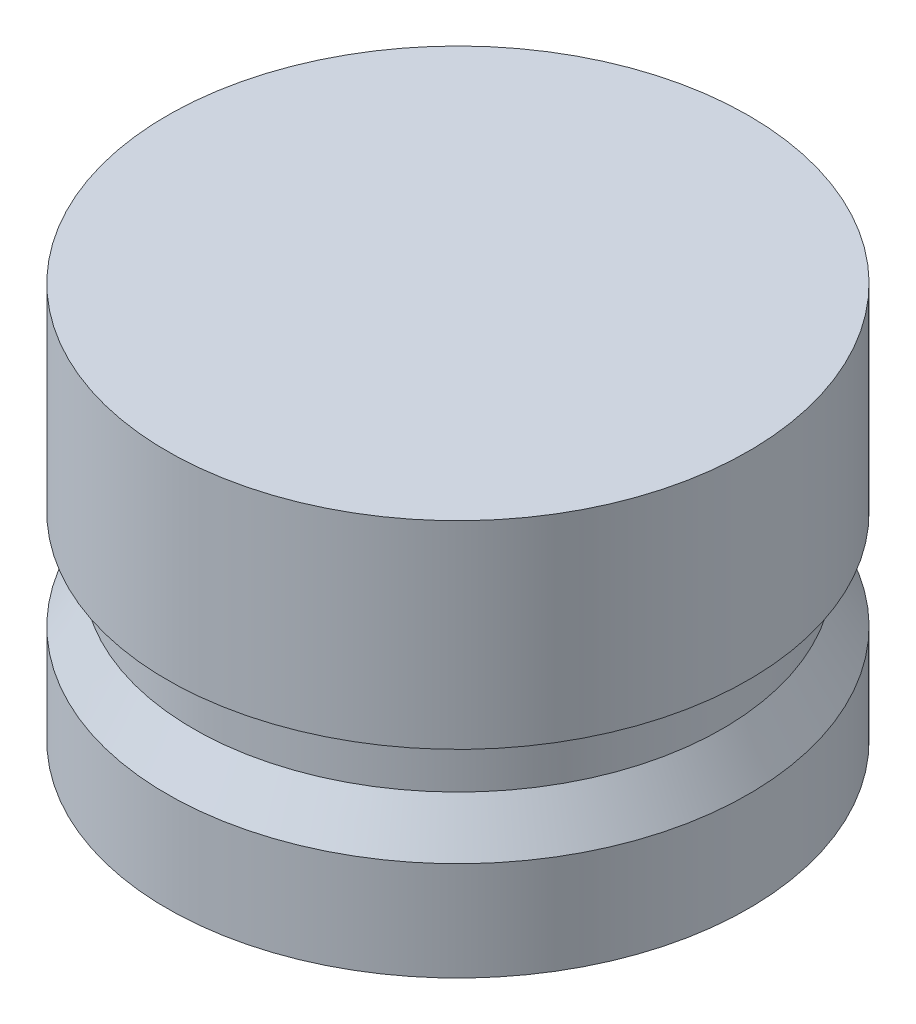
from build123d import *


with BuildPart() as part:
    # Sketch1 → Revolve1 (revolve)
    with BuildSketch(Plane.XY):
        Polygon((0, 0), (-9.3218, 0), (-9.3218, 3.175), (-8.4836, 4.572), (-8.4836, 6.35), (-9.3218, 6.35), (-9.3218, 12.7), (0, 12.7), align=None)
    revolve(axis=Axis((0, 0, 0), (0, 1, 0)))


solid = part.part
